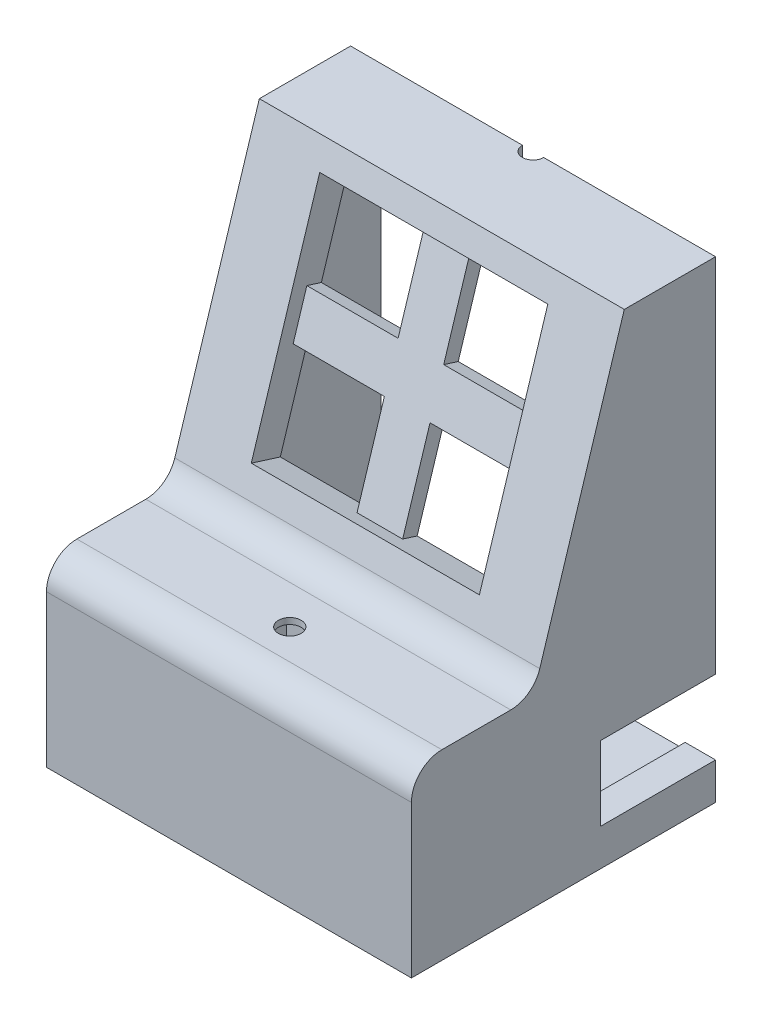
from build123d import *

# Parameters (mm, degrees)
BOSS_EXTRU_1_DEPTH      = 120
COQUE1_START            = 10
COQUE1_DEPTH            = 100
ESQUISSE3_W             = 75
ESQUISSE3_H             = 75
ENL_V_MAT_EXTRU_1_DEPTH = 5
ENL_V_MAT_EXTRU_2_REACH = 194.855
ESQUISSE4_W             = 30
ESQUISSE4_H             = 30
ESQUISSE5_R             = 3.25
ENL_V_MAT_EXTRU_3_DEPTH = 3.5
ENL_V_START             = 50
ESQUISSE6_R             = 3.75
ENL_V_MAT_EXTRU_4_DEPTH = 10
ESQUISSE7_W             = 14
ESQUISSE7_H             = 12
ENL_V_MAT_EXTRU_5_DEPTH = 8
ESQUISSE8_W             = 37.840944821
ESQUISSE8_H             = 24.41449918
ENL_V_MAT_EXTRU_6_DEPTH = 10
ENL_V_START_2           = 145.39392
ESQUISSE9_R             = 3.5
ENL_V_MAT_EXTRU_8_DEPTH = 25


# Read off the part's stored shape, not the designer's step: Coque1
with BuildPart() as part:
    # Esquisse1 → Boss.-Extru.1 (new body)
    with BuildSketch(Plane(origin=(0, 0, 0), x_dir=(0, 0, -1), z_dir=(1, 0, 0))):
        with BuildLine():
            Line((0, 0), (-100, 0))
            Line((-100, 0), (-100, 50))
            ThreePointArc((-100, 50), (-97.071067812, 57.071067812), (-90, 60))
            Line((-90, 60), (-67.337993857, 60))
            ThreePointArc((-67.337993857, 60), (-61.421914074, 61.937742252), (-57.798601843, 67))
            Line((-57.798601843, 67), (-30, 155.393920142))
            Line((-30, 155.393920142), (0, 155.393920142))
            Line((0, 155.393920142), (0, 0))
        make_face()
    extrude(amount=BOSS_EXTRU_1_DEPTH)

    # Coque1 outline → Coque1 (cut)
    with BuildSketch(Plane.YZ.offset(COQUE1_START)):
        with BuildLine():
            Line((145.393920142, 0), (145.393920142, 22.662006143))
            Line((145.393920142, 22.662006143), (64, 48.259209829))
            ThreePointArc((64, 48.259209829), (53.875484503, 55.505834291), (50, 67.337993857))
            Line((50, 67.337993857), (50, 90))
            Line((50, 90), (10, 90))
            Line((10, 90), (10, 0))
            Line((10, 0), (145.393920142, 0))
        make_face()
    extrude(amount=COQUE1_DEPTH, mode=Mode.SUBTRACT)

    # Esquisse3 → Enlèv. mat.-Extru.1 (cut)
    with BuildSketch(Plane(origin=(0, 22.570905626, 71.770905626), x_dir=(-1, 0, 0), z_dir=(0, -0.3000000000000002, -0.9539392014169457))):
        with Locations((-60, 92.905349014)):
            Rectangle(ESQUISSE3_W, ESQUISSE3_H)
    extrude(amount=ENL_V_MAT_EXTRU_1_DEPTH, mode=Mode.SUBTRACT)

    # Esquisse4 → Enlèv. mat.-Extru.2 (cut, up to next)
    with BuildSketch(Plane(origin=(0, 22.570905626, 71.770905626), x_dir=(-1, 0, 0), z_dir=(0, -0.3000000000000002, -0.9539392014169457)), mode=Mode.PRIVATE) as enl_v_mat_extru_2_sk1:
        with Locations((-37.5, 115.405349014)):
            Rectangle(ESQUISSE4_W, ESQUISSE4_H)
    enl_v_mat_extru_2_tool1 = extrude(enl_v_mat_extru_2_sk1.sketch, amount=ENL_V_MAT_EXTRU_2_REACH, mode=Mode.PRIVATE) & part.part
    # Esquisse4 → Enlèv. mat.-Extru.2 (cut, up to next)
    with BuildSketch(Plane(origin=(0, 22.570905626, 71.770905626), x_dir=(-1, 0, 0), z_dir=(0, -0.3000000000000002, -0.9539392014169457)), mode=Mode.PRIVATE) as enl_v_mat_extru_2_sk2:
        with Locations((-37.5, 70.405349014)):
            Rectangle(ESQUISSE4_W, ESQUISSE4_H)
    enl_v_mat_extru_2_tool2 = extrude(enl_v_mat_extru_2_sk2.sketch, amount=ENL_V_MAT_EXTRU_2_REACH, mode=Mode.PRIVATE) & part.part
    # Esquisse4 → Enlèv. mat.-Extru.2 (cut, up to next)
    with BuildSketch(Plane(origin=(0, 22.570905626, 71.770905626), x_dir=(-1, 0, 0), z_dir=(0, -0.3000000000000002, -0.9539392014169457)), mode=Mode.PRIVATE) as enl_v_mat_extru_2_sk3:
        with Locations((-82.5, 115.405349014)):
            Rectangle(ESQUISSE4_W, ESQUISSE4_H)
    enl_v_mat_extru_2_tool3 = extrude(enl_v_mat_extru_2_sk3.sketch, amount=ENL_V_MAT_EXTRU_2_REACH, mode=Mode.PRIVATE) & part.part
    # Esquisse4 → Enlèv. mat.-Extru.2 (cut, up to next)
    with BuildSketch(Plane(origin=(0, 22.570905626, 71.770905626), x_dir=(-1, 0, 0), z_dir=(0, -0.3000000000000002, -0.9539392014169457)), mode=Mode.PRIVATE) as enl_v_mat_extru_2_sk4:
        with Locations((-82.5, 70.405349014)):
            Rectangle(ESQUISSE4_W, ESQUISSE4_H)
    enl_v_mat_extru_2_tool4 = extrude(enl_v_mat_extru_2_sk4.sketch, amount=ENL_V_MAT_EXTRU_2_REACH, mode=Mode.PRIVATE) & part.part
    add(enl_v_mat_extru_2_tool1.solids().sort_by_distance((37.5, 132.660592, 37.149301))[0], mode=Mode.SUBTRACT)
    add(enl_v_mat_extru_2_tool2.solids().sort_by_distance((37.5, 89.733328, 50.649301))[0], mode=Mode.SUBTRACT)
    add(enl_v_mat_extru_2_tool3.solids().sort_by_distance((82.5, 132.660592, 37.149301))[0], mode=Mode.SUBTRACT)
    add(enl_v_mat_extru_2_tool4.solids().sort_by_distance((82.5, 89.733328, 50.649301))[0], mode=Mode.SUBTRACT)

    # Esquisse5 → Enlèv. mat.-Extru.3 (cut)
    with BuildSketch(Plane(origin=(0, 0, 0), x_dir=(-1, 0, 0), z_dir=(0, 0, -1))):
        with Locations(Location((-114.715748307, 149.926194797, 0), (0, 0, 90))):
            Circle(ESQUISSE5_R)
        with Locations(Location((-5.284251693, 149.926194797, 0), (0, 0, 270))):
            Circle(ESQUISSE5_R)
        with Locations(Location((-5.284251693, 5.467725345, 0), (0, 0, 90))):
            Circle(ESQUISSE5_R)
        with Locations(Location((-114.715748307, 5.467725345, 0), (0, 0, 270))):
            Circle(ESQUISSE5_R)
    extrude(amount=-ENL_V_MAT_EXTRU_3_DEPTH, mode=Mode.SUBTRACT)

    # Esquisse6 → Enlèv. mat.-Extru.4 (cut)
    with BuildSketch(Plane(origin=(0, 0, 0), x_dir=(1, 0, 0), z_dir=(0, 1, 0)).offset(ENL_V_START)):
        with Locations(Location((60, -80, 0), (0, 0, 90))):
            Circle(ESQUISSE6_R)
    extrude(amount=ENL_V_MAT_EXTRU_4_DEPTH, mode=Mode.SUBTRACT)

    # Esquisse7 → Enlèv. mat.-Extru.5 (cut)
    with BuildSketch(Plane(origin=(0, 0, 0), x_dir=(1, 0, 0), z_dir=(0, 1, 0)).offset(ENL_V_START)):
        with Locations((60, -80)):
            Rectangle(ESQUISSE7_W, ESQUISSE7_H)
    extrude(amount=ENL_V_MAT_EXTRU_5_DEPTH, mode=Mode.SUBTRACT)

    # Esquisse8 → Enlèv. mat.-Extru.6 (cut)
    with BuildSketch(Plane(origin=(120, 0, 0), x_dir=(0, 0, -1), z_dir=(1, 0, 0))):
        with Locations((-18.920472411, 24.304309827)):
            Rectangle(ESQUISSE8_W, ESQUISSE8_H)
    extrude(amount=-ENL_V_MAT_EXTRU_6_DEPTH, mode=Mode.SUBTRACT)

    # Esquisse9 → Enlèv. mat.-Extru.8 (cut)
    with BuildSketch(Plane(origin=(0, 0, 0), x_dir=(1, 0, 0), z_dir=(0, 1, 0)).offset(ENL_V_START_2)):
        with Locations((60, 0)):
            Circle(ESQUISSE9_R)
    extrude(amount=ENL_V_MAT_EXTRU_8_DEPTH, mode=Mode.SUBTRACT)


solid = part.part
